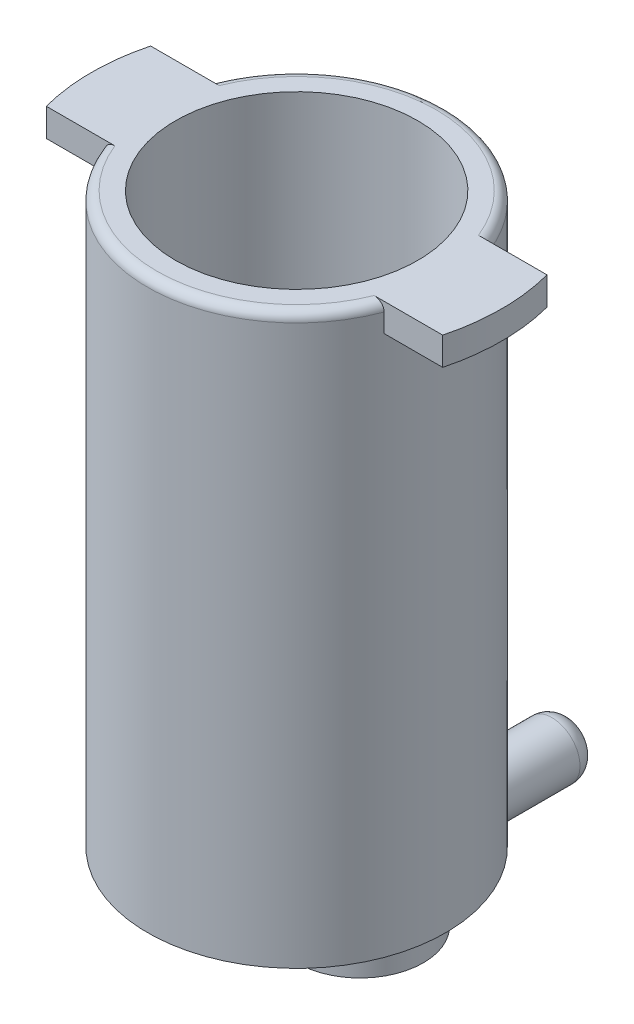
from build123d import *

# Parameters (mm, degrees)
SKETCH1_R           = 8
BOSS_EXTRUDE1_DEPTH = 30.5
SHELL1_T            = -1.5
SKETCH2_R           = 3.4
BOSS_EXTRUDE2_DEPTH = 5.4
SHELL2_START        = -3.9
SHELL2_OUTLINE_R    = 1.9
SHELL2_DEPTH        = 5.4
SKETCH5_R           = 2.45
BOSS_EXTRUDE5_DEPTH = 4.9
SKETCH6_R           = 1.5
BOSS_EXTRUDE6_DEPTH = 6.3
SKETCH7_R           = 0.95
CUT_EXTRUDE1_DEPTH  = 11.3
SKETCH8_R           = 1.9
CUT_EXTRUDE2_DEPTH  = 39.216750365
FILLET1_R           = 1
FILLET2_R           = 0.5
BOSS_EXTRUDE7_START = -1.5
BOSS_EXTRUDE7_DEPTH = 1.5


# Read off the part's stored shape, not the designer's step: Shell2
with BuildPart() as part:
    # Sketch1 → Boss-Extrude1 (new body)
    with BuildSketch(Plane(origin=(0, 0, 0), x_dir=(1, 0, 0), z_dir=(0, 1, 0))):
        with Locations(Location((0, 0, 0), (0, 0, 90))):
            Circle(SKETCH1_R)
    extrude(amount=BOSS_EXTRUDE1_DEPTH)

    # Shell1
    shell1_openings = [part.faces().sort_by_distance(p)[0] for p in [
        (0, 30.5, 0),
    ]]
    offset(amount=SHELL1_T, openings=shell1_openings, kind=Kind.INTERSECTION)

    # Sketch2 → Boss-Extrude2 (add)
    with BuildSketch(Plane.XZ):
        with Locations(Location((0, -3.4, 0), (0, 0, 90))):
            Circle(SKETCH2_R)
    extrude(amount=BOSS_EXTRUDE2_DEPTH)

    # Shell2 outline → Shell2 (cut)
    with BuildSketch(Plane(origin=(0, 0, 0), x_dir=(1, 0, 0), z_dir=(0, 1, 0)).offset(SHELL2_START)):
        with Locations((0, 3.4)):
            Circle(SHELL2_OUTLINE_R)
    extrude(amount=SHELL2_DEPTH, mode=Mode.SUBTRACT)

    # Sketch5 → Boss-Extrude5 (add)
    with BuildSketch(Plane.XY.offset(-3.4)):
        with Locations((0, -2.35384725)):
            Circle(SKETCH5_R)
    extrude(amount=-BOSS_EXTRUDE5_DEPTH)

    # Sketch6 → Boss-Extrude6 (add)
    with BuildSketch(Plane(origin=(0, 0, -8.3), x_dir=(-1, 0, 0), z_dir=(0, 0, -1))):
        with Locations((0, -2.35384725)):
            Circle(SKETCH6_R)
    extrude(amount=BOSS_EXTRUDE6_DEPTH)

    # Sketch7 → Cut-Extrude1 (cut)
    with BuildSketch(Plane(origin=(0, 0, -14.6), x_dir=(-1, 0, 0), z_dir=(0, 0, -1))):
        with Locations((0, -2.35384725)):
            Circle(SKETCH7_R)
    extrude(amount=-CUT_EXTRUDE1_DEPTH, mode=Mode.SUBTRACT)

    # Sketch8 → Cut-Extrude2 (cut, through all)
    with BuildSketch(Plane(origin=(0, -3.9, 0), x_dir=(1, 0, 0), z_dir=(0, 1, 0))):
        with Locations(Location((0, 3.4, 0), (0, 0, 270))):
            Circle(SKETCH8_R)
    extrude(amount=CUT_EXTRUDE2_DEPTH, mode=Mode.SUBTRACT)

    # Fillet1
    # the kernel refuses this fillet: 1 mm, written as the material it takes off along each edge
    with BuildSketch(Plane(origin=(0, -2.35384725, -14.6), x_dir=(-1, 0, 0), z_dir=(0, -1, 0))) as fillet1_piece_1:
        with BuildLine():
            CenterArc((0.5, -0.893028555), FILLET1_R, 0, 63.25631605)
            Line((1.5, -0.893028555), (1.52, -0.893028555))
            Line((1.52, -0.893028555), (1.52, 0))
            Line((1.52, 0), (1.5, 0.02))
            ThreePointArc((1.5, 0.02), (1.225, 0.02), (0.959, 0.017860571))
            Line((0.959, 0.017860571), (0.95, 0))
        make_face()
    revolve(axis=Axis((0, -2.35384725, -14.6), (0, 0, -1)), mode=Mode.SUBTRACT)

    # Fillet2
    fillet2_edges = [part.edges().sort_by_distance(p)[0] for p in [
        (0, 30.5, 8),
    ]]
    fillet(fillet2_edges, radius=FILLET2_R)

    # Sketch9 → Boss-Extrude7 (add)
    with BuildSketch(Plane(origin=(0, 30.5, 0), x_dir=(1, 0, 0), z_dir=(0, 1, 0)).offset(BOSS_EXTRUDE7_START)):
        with BuildLine():
            Line((-10.637668918, 2.8), (-5.86600375, 2.8))
            ThreePointArc((-5.86600375, 2.8), (-6.5, 0), (-5.86600375, -2.8))
            Line((-5.86600375, -2.8), (-10.637668918, -2.8))
            ThreePointArc((-10.637668918, -2.8), (-11, 0), (-10.637668918, 2.8))
        make_face()
    extrude(amount=BOSS_EXTRUDE7_DEPTH)

    # Mirror1: part across plane


with BuildPart() as part_1:
    add(part.part)
    add(part.part.mirror(Plane(origin=(0, 0, 0), x_dir=(0, 0, 1), z_dir=(1, 0, 0))))


solid = part_1.part
